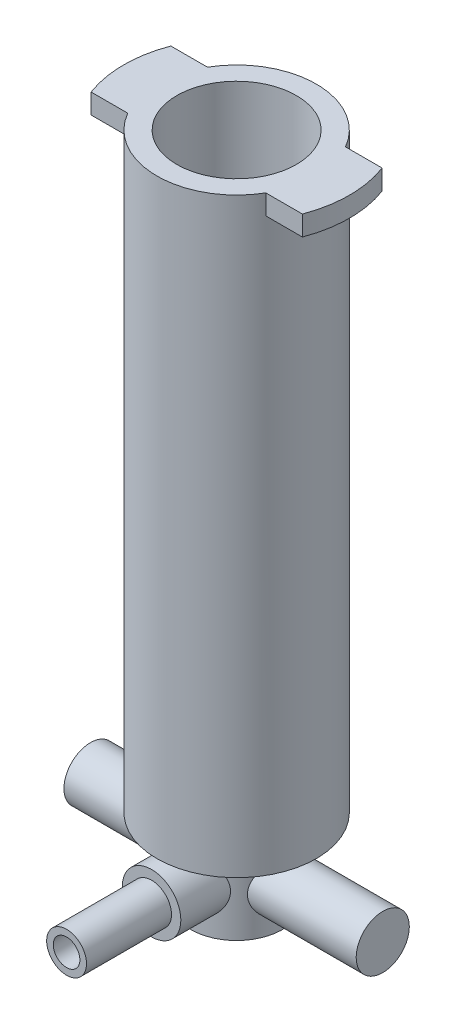
from build123d import *

# Parameters (mm, degrees)
SKETCH1_R           = 6
BOSS_EXTRUDE1_DEPTH = 44.5
SHELL1_T            = -1.5
SKETCH3_R           = 3.45
BOSS_EXTRUDE3_DEPTH = 5.9
SHELL2_START        = -4.4
SHELL2_OUTLINE_R    = 1.95
SHELL2_DEPTH        = 5.9
SKETCH5_R           = 2.2
BOSS_EXTRUDE4_DEPTH = 6.4
SKETCH6_R           = 1.5
BOSS_EXTRUDE5_DEPTH = 6.4
SKETCH7_R           = 1
CUT_EXTRUDE1_DEPTH  = 12.4
SKETCH8_R           = 1.95
CUT_EXTRUDE2_DEPTH  = 51.902357509
SKETCH9_R           = 2
BOSS_EXTRUDE6_DEPTH = 11
SKETCH10_R          = 1.975
CUT_EXTRUDE3_DEPTH  = 52.730551947
SKETCH11_R          = 1
CUT_EXTRUDE4_DEPTH  = 12
BOSS_EXTRUDE8_START = -1.5
BOSS_EXTRUDE8_DEPTH = 1.5


# Read off the part's stored shape, not the designer's step: Shell2
with BuildPart() as part:
    # Sketch1 → Boss-Extrude1 (new body)
    with BuildSketch(Plane(origin=(0, 0, 0), x_dir=(1, 0, 0), z_dir=(0, 1, 0))):
        with Locations(Location((0, 0, 0), (0, 0, 270))):
            Circle(SKETCH1_R)
    extrude(amount=BOSS_EXTRUDE1_DEPTH)

    # Shell1
    shell1_openings = [part.faces().sort_by_distance(p)[0] for p in [
        (0, 44.5, 0),
    ]]
    offset(amount=SHELL1_T, openings=shell1_openings, kind=Kind.INTERSECTION)

    # Sketch3 → Boss-Extrude3 (add)
    with BuildSketch(Plane.XZ):
        with Locations(Location((0, 0, 0), (0, 0, 270))):
            Circle(SKETCH3_R)
    extrude(amount=BOSS_EXTRUDE3_DEPTH)

    # Shell2 outline → Shell2 (cut)
    with BuildSketch(Plane(origin=(0, 0, 0), x_dir=(1, 0, 0), z_dir=(0, 1, 0)).offset(SHELL2_START)):
        Circle(SHELL2_OUTLINE_R)
    extrude(amount=SHELL2_DEPTH, mode=Mode.SUBTRACT)

    # Sketch5 → Boss-Extrude4 (add)
    with BuildSketch(Plane.XY):
        with Locations(Location((0, -2.70320485, 0), (0, 0, 270))):
            Circle(SKETCH5_R)
    extrude(amount=BOSS_EXTRUDE4_DEPTH)

    # Sketch6 → Boss-Extrude5 (add)
    with BuildSketch(Plane.XY.offset(6.4)):
        with Locations((0, -2.70320485)):
            Circle(SKETCH6_R)
    extrude(amount=BOSS_EXTRUDE5_DEPTH)

    # Sketch7 → Cut-Extrude1 (cut)
    with BuildSketch(Plane.XY.offset(12.8)):
        with Locations((0, -2.70320485)):
            Circle(SKETCH7_R)
    extrude(amount=-CUT_EXTRUDE1_DEPTH, mode=Mode.SUBTRACT)

    # Sketch8 → Cut-Extrude2 (cut, through all)
    with BuildSketch(Plane(origin=(0, -4.4, 0), x_dir=(1, 0, 0), z_dir=(0, 1, 0))):
        with Locations(Location((0, 0, 0), (0, 0, 270))):
            Circle(SKETCH8_R)
    extrude(amount=CUT_EXTRUDE2_DEPTH, mode=Mode.SUBTRACT)

    # Sketch9 → Boss-Extrude6 (add)
    with BuildSketch(Plane(origin=(0, 0, 0), x_dir=(0, 0, -1), z_dir=(1, 0, 0))):
        with Locations(Location((0, -2.934503104, 0), (0, 0, 180))):
            Circle(SKETCH9_R)
    extrude(amount=BOSS_EXTRUDE6_DEPTH)

    # Sketch10 → Cut-Extrude3 (cut, through all)
    with BuildSketch(Plane(origin=(0, -4.4, 0), x_dir=(1, 0, 0), z_dir=(0, 1, 0))):
        with Locations(Location((0, -0.025, 0), (0, 0, 270))):
            Circle(SKETCH10_R)
    extrude(amount=CUT_EXTRUDE3_DEPTH, mode=Mode.SUBTRACT)

    # Sketch11 → Cut-Extrude4 (cut)
    with BuildSketch(Plane.XY.offset(12.8)):
        with Locations((0, -2.70320485)):
            Circle(SKETCH11_R)
    extrude(amount=-CUT_EXTRUDE4_DEPTH, mode=Mode.SUBTRACT)

    # Mirror5: part across plane


with BuildPart() as part_1:
    add(part.part)
    add(part.part.mirror(Plane(origin=(0, 0, 0), x_dir=(0, 0, 1), z_dir=(1, 0, 0))))

    # Sketch13 → Boss-Extrude8 (add)
    with BuildSketch(Plane(origin=(0, 44.5, 0), x_dir=(1, 0, 0), z_dir=(0, 1, 0)).offset(BOSS_EXTRUDE8_START)):
        with BuildLine():
            Line((-5.196152423, -3), (-7.95298686, -3))
            ThreePointArc((-7.95298686, -3), (-8.5, 0), (-7.95298686, 3))
            Line((-7.95298686, 3), (-5.196152423, 3))
            ThreePointArc((-5.196152423, 3), (-6, 0), (-5.196152423, -3))
        make_face()
        with BuildLine():
            Line((5.196152423, -3), (7.95298686, -3))
            ThreePointArc((7.95298686, -3), (8.5, 0), (7.95298686, 3))
            Line((7.95298686, 3), (5.196152423, 3))
            ThreePointArc((5.196152423, 3), (6, 0), (5.196152423, -3))
        make_face()
    extrude(amount=BOSS_EXTRUDE8_DEPTH)


solid = part_1.part
